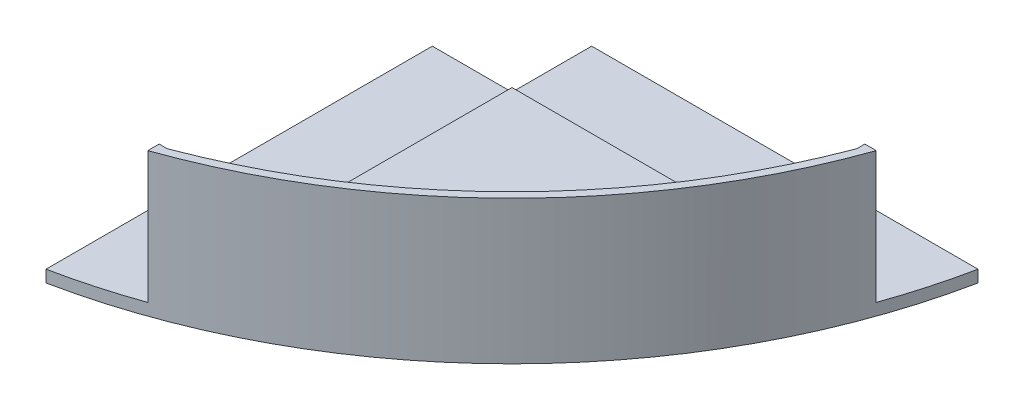
from build123d import *

# Parameters (mm, degrees)
BOSS_EXTRUDE1_DEPTH = 3
BOSS_EXTRUDE2_DEPTH = 33
SHELL2_START        = 2
SHELL2_DEPTH        = 34
SKETCH9_W           = 86.564064606
SKETCH9_H           = 33
SKETCH9_W_2         = 2
CUT_EXTRUDE3_DEPTH  = 3
SKETCH10_W          = 88.564064606
SKETCH10_H          = 33
CUT_EXTRUDE4_DEPTH  = 3
BOSS_EXTRUDE9_DEPTH = 6


# Read off the part's stored shape, not the designer's step: Shell2
with BuildPart() as part:
    # Sketch1 → Boss-Extrude1 (new body)
    with BuildSketch(Plane(origin=(0, 0, 0), x_dir=(1, 0, 0), z_dir=(0, 1, 0))):
        with BuildLine():
            Line((141.421356237, -50), (50, -50))
            Line((50, -50), (50, -141.421356237))
            ThreePointArc((50, -141.421356237), (106.066017178, -106.066017178), (141.421356237, -50))
        make_face()
        with BuildLine():
            Line((50, -50), (30, -50))
            Line((30, -50), (30, -146.969384567))
            ThreePointArc((30, -146.969384567), (40.096074055, -144.541706249), (50, -141.421356237))
            Line((50, -141.421356237), (50, -50))
        make_face()
        with BuildLine():
            Line((50, -30), (50, -50))
            Line((50, -50), (141.421356237, -50))
            ThreePointArc((141.421356237, -50), (144.541706249, -40.096074055), (146.969384567, -30))
            Line((146.969384567, -30), (50, -30))
        make_face()
    extrude(amount=BOSS_EXTRUDE1_DEPTH)

    # Sketch2 → Boss-Extrude2 (add)
    with BuildSketch(Plane(origin=(0, 3, 0), x_dir=(-1, 0, 0), z_dir=(0, 1, 0))):
        with BuildLine():
            Line((-141.421356237, 50), (-50, 50))
            Line((-50, 50), (-50, 141.421356237))
            ThreePointArc((-50, 141.421356237), (-106.066017178, 106.066017178), (-141.421356237, 50))
        make_face()
    extrude(amount=BOSS_EXTRUDE2_DEPTH)

    # Shell2 outline → Shell2 (cut)
    with BuildSketch(Plane(origin=(0, 0, 0), x_dir=(1, 0, 0), z_dir=(0, 1, 0)).offset(SHELL2_START)):
        with BuildLine():
            ThreePointArc((52, -138.564064606), (104.651803616, -104.651803616), (138.564064606, -52))
            Line((138.564064606, -52), (52, -52))
            Line((52, -52), (52, -138.564064606))
        make_face()
    extrude(amount=SHELL2_DEPTH, mode=Mode.SUBTRACT)

    # Sketch9 → Cut-Extrude3 (cut)
    with BuildSketch(Plane.XY.offset(52)):
        with Locations((95.282032303, 19.5)):
            Rectangle(SKETCH9_W, SKETCH9_H)
        with Locations((51, 19.5)):
            Rectangle(SKETCH9_W_2, SKETCH9_H)
    extrude(amount=-CUT_EXTRUDE3_DEPTH, mode=Mode.SUBTRACT)

    # Sketch10 → Cut-Extrude4 (cut)
    with BuildSketch(Plane(origin=(52, 0, 0), x_dir=(0, 0, -1), z_dir=(1, 0, 0))):
        with Locations((-94.282032303, 19.5)):
            Rectangle(SKETCH10_W, SKETCH10_H)
    extrude(amount=-CUT_EXTRUDE4_DEPTH, mode=Mode.SUBTRACT)

    # Sketch11 → Boss-Extrude9 (add)
    with BuildSketch(Plane.XZ):
        with BuildLine():
            ThreePointArc((52, 138.564064606), (104.651803616, 104.651803616), (138.564064606, 52))
            Line((138.564064606, 52), (52, 52))
            Line((52, 52), (52, 138.564064606))
        make_face()
    extrude(amount=-BOSS_EXTRUDE9_DEPTH)


solid = part.part
